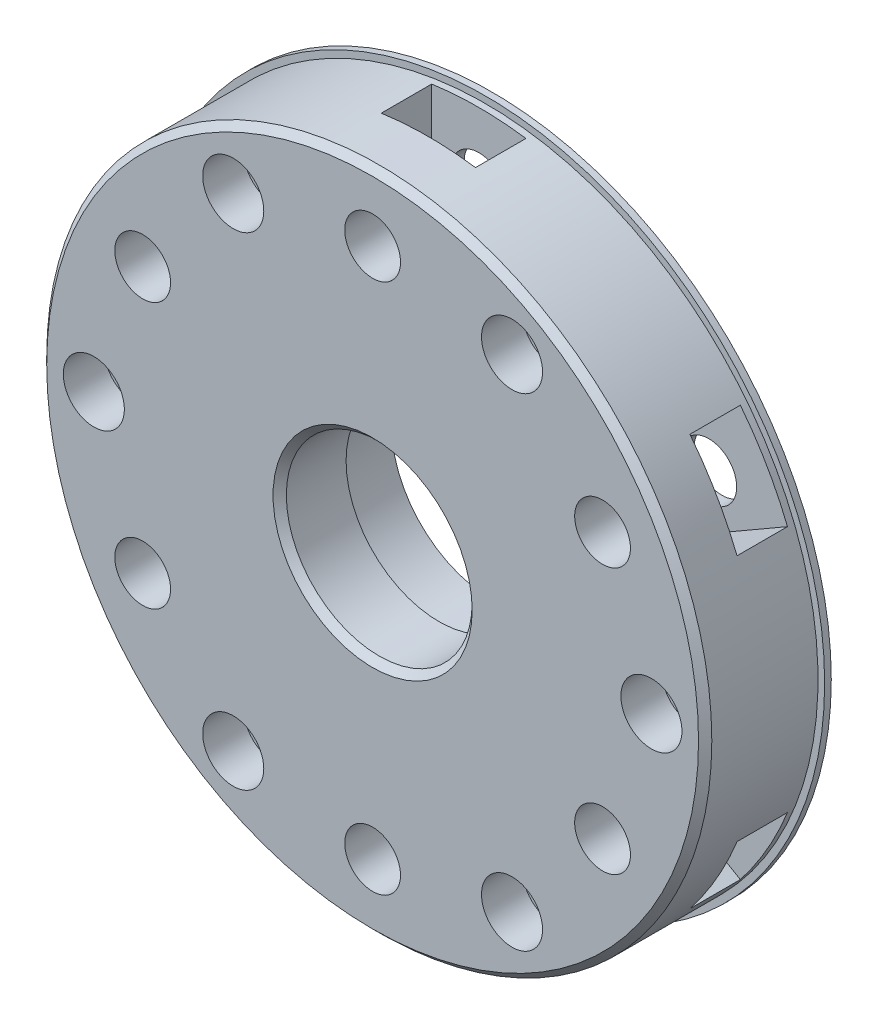
from build123d import *

# Parameters (mm, degrees)
OUTPUT_MASTER_SKETCH_R  = 25.05
BOSS_EXTRUDE1_DEPTH     = 9
SKETCH4_R               = 2.95
CUT_EXTRUDE1_DEPTH      = 4
SKETCH5_R               = 25.55
SKETCH5_R_2             = 25.05
BOSS_EXTRUDE2_DEPTH     = 0.5
SKETCH6_R               = 1.55
CUT_EXTRUDE2_DEPTH      = 38.237145433
SKETCH7_R               = 2.3
CUT_EXTRUDE3_DEPTH      = 3.1
CHAMFER1_SIZE           = 0.5
SKETCH8_R               = 7
CUT_EXTRUDE4_DEPTH      = 10
SKETCH9_R               = 7.575
CUT_EXTRUDE5_DEPTH      = 4
SKETCH10_R              = 2.1
M4_THRU_DEPTH           = 38.237145433
CHAMFER3_SIZE           = 0.5
M4_START                = -8
M4_HEXNUT_CUT_DEPTH     = 3.8
SKETCH12_W              = 7.1
SKETCH12_H              = 3.8
M4_HEXNUT_SLOT_DEPTH    = 55.767908461
M4_HEXNUT_PATTERN_COUNT = 6


with BuildPart() as part:
    # Output Master Sketch → Boss-Extrude1 (new body)
    with BuildSketch(Plane.XY):
        Circle(OUTPUT_MASTER_SKETCH_R)
    extrude(amount=BOSS_EXTRUDE1_DEPTH)

    # Sketch4 → Cut-Extrude1 (cut)
    with BuildSketch(Plane.XY):
        with Locations((21, 0)):
            Circle(SKETCH4_R)
        with Locations((10.5, -18.186533479)):
            Circle(SKETCH4_R)
        with Locations((-10.5, -18.186533479)):
            Circle(SKETCH4_R)
        with Locations((-21, 0)):
            Circle(SKETCH4_R)
        with Locations((-10.5, 18.186533479)):
            Circle(SKETCH4_R)
        with Locations((10.5, 18.186533479)):
            Circle(SKETCH4_R)
    extrude(amount=CUT_EXTRUDE1_DEPTH, mode=Mode.SUBTRACT)

    # Sketch5 → Boss-Extrude2 (add)
    with BuildSketch(Plane(origin=(0, 0, 0), x_dir=(-1, 0, 0), z_dir=(0, 0, -1))):
        Circle(SKETCH5_R)
        Circle(SKETCH5_R_2, mode=Mode.SUBTRACT)
    extrude(amount=-BOSS_EXTRUDE2_DEPTH)

    # Sketch6 → Cut-Extrude2 (cut, through all)
    with BuildSketch(Plane(origin=(0, 0, 0), x_dir=(-1, 0, 0), z_dir=(0, 0, -1))):
        with Locations((-21, 0)):
            Circle(SKETCH6_R)
        with Locations((-10.5, 18.186533479)):
            Circle(SKETCH6_R)
        with Locations((10.5, 18.186533479)):
            Circle(SKETCH6_R)
        with Locations((21, 0)):
            Circle(SKETCH6_R)
        with Locations((10.5, -18.186533479)):
            Circle(SKETCH6_R)
        with Locations((-10.5, -18.186533479)):
            Circle(SKETCH6_R)
    extrude(amount=-CUT_EXTRUDE2_DEPTH, mode=Mode.SUBTRACT)

    # Sketch7 → Cut-Extrude3 (cut)
    with BuildSketch(Plane.XY.offset(9)):
        with Locations((-21, 0)):
            Circle(SKETCH7_R)
        with Locations((-10.5, 18.186533479)):
            Circle(SKETCH7_R)
        with Locations((10.5, 18.186533479)):
            Circle(SKETCH7_R)
        with Locations((21, 0)):
            Circle(SKETCH7_R)
        with Locations((10.5, -18.186533479)):
            Circle(SKETCH7_R)
        with Locations((-10.5, -18.186533479)):
            Circle(SKETCH7_R)
    extrude(amount=-CUT_EXTRUDE3_DEPTH, mode=Mode.SUBTRACT)

    # Chamfer1
    chamfer1_edges = [part.edges().sort_by_distance(p)[0] for p in [
        (-25.05, 0, 9),
    ]]
    chamfer(chamfer1_edges, length=CHAMFER1_SIZE)

    # Sketch8 → Cut-Extrude4 (cut)
    with BuildSketch(Plane(origin=(0, 0, 0), x_dir=(-1, 0, 0), z_dir=(0, 0, -1))):
        Circle(SKETCH8_R)
    extrude(amount=-CUT_EXTRUDE4_DEPTH, mode=Mode.SUBTRACT)

    # Sketch9 → Cut-Extrude5 (cut)
    with BuildSketch(Plane(origin=(0, 0, 0), x_dir=(-1, 0, 0), z_dir=(0, 0, -1))):
        Circle(SKETCH9_R)
    extrude(amount=-CUT_EXTRUDE5_DEPTH, mode=Mode.SUBTRACT)

    # Sketch10 → M4 Thru (cut, through all)
    with BuildSketch(Plane.XY.offset(9)):
        with Locations((0, 20)):
            Circle(SKETCH10_R)
        with Locations((17.320508076, 10)):
            Circle(SKETCH10_R)
        with Locations((17.320508076, -10)):
            Circle(SKETCH10_R)
        with Locations((0, -20)):
            Circle(SKETCH10_R)
        with Locations((-17.320508076, -10)):
            Circle(SKETCH10_R)
        with Locations((-17.320508076, 10)):
            Circle(SKETCH10_R)
    extrude(amount=-M4_THRU_DEPTH, mode=Mode.SUBTRACT)

    # Chamfer3
    chamfer3_edges = [part.edges().sort_by_distance(p)[0] for p in [
        (7, 0, 9),
    ]]
    chamfer(chamfer3_edges, length=CHAMFER3_SIZE)

    # Sketch11 → M4 Hexnut Cut (cut)
    with BuildSketch(Plane.XY.offset(9).offset(M4_START)):
        Polygon((0, 24.099186911), (-3.55, 22.049593456), (-3.55, 17.950406544), (0, 15.900813089), (3.55, 17.950406544), (3.55, 22.049593456), align=None)
    m4_hexnut_cut = extrude(amount=M4_HEXNUT_CUT_DEPTH, mode=Mode.SUBTRACT)

    # Sketch12 → M4 Hexnut Slot (cut, through all)
    with BuildSketch(Plane(origin=(0, 22.049593456, 0), x_dir=(1, 0, 0), z_dir=(0, 1, 0))):
        with Locations((0, -2.9)):
            Rectangle(SKETCH12_W, SKETCH12_H)
    m4_hexnut_slot = extrude(amount=M4_HEXNUT_SLOT_DEPTH, mode=Mode.SUBTRACT)

    # M4 Hexnut Pattern: M4 Hexnut Cut, M4 Hexnut Slot ×6 about axis
    m4_hexnut_pattern_axis = Axis((0, 0, 10), (0, 0, -1))
    add([m4_hexnut_cut.rotate(m4_hexnut_pattern_axis, i * 360 / M4_HEXNUT_PATTERN_COUNT) for i in range(1, M4_HEXNUT_PATTERN_COUNT)], mode=Mode.SUBTRACT)
    add([m4_hexnut_slot.rotate(m4_hexnut_pattern_axis, i * 360 / M4_HEXNUT_PATTERN_COUNT) for i in range(1, M4_HEXNUT_PATTERN_COUNT)], mode=Mode.SUBTRACT)


solid = part.part
